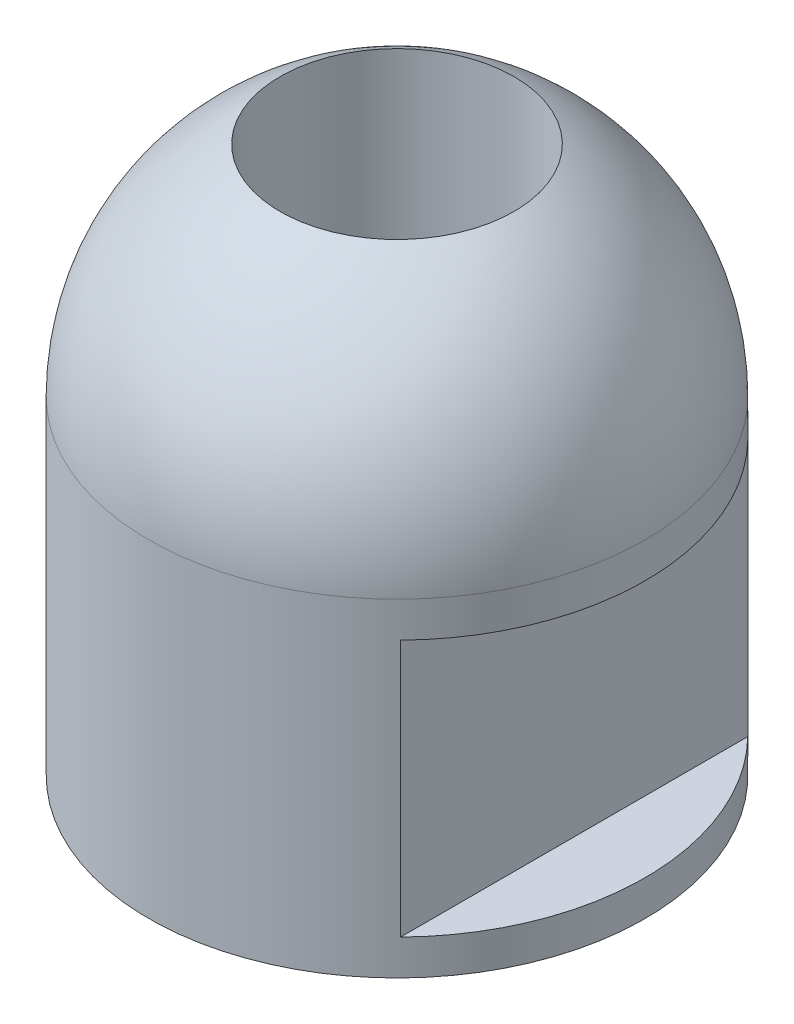
from build123d import *

# Parameters (mm, degrees)
TAP_DRILL_FOR_M4X0_7_TAP1_D = 3.3
CUT_EXTRUDE1_DEPTH          = 10.165790389
CUT_EXTRUDE1_DEPTH_BACK     = 10.165790389
SKETCH5_W                   = 1
SKETCH5_H                   = 3.627718677


with BuildPart() as part:
    # Sketch1 → Revolve1 (revolve)
    with BuildSketch(Plane.XY):
        with BuildLine():
            Line((0, 0), (0, 8.127718677))
            ThreePointArc((0, 8.127718677), (2.474873734, 7.102592411), (3.5, 4.627718677))
            Line((3.5, 4.627718677), (3.5, 0))
            Line((3.5, 0), (0, 0))
        make_face()
    revolve(axis=Axis((0, 8.127718677, 0), (0, 1, 0)))

    # Tap Drill for M4x0.7 Tap1 (through all)
    with Locations(Plane(origin=(0, 0, 0), x_dir=(-1, 0, 0), z_dir=(0, -1, 0))):
        with Locations((0, 0)):
            Hole(TAP_DRILL_FOR_M4X0_7_TAP1_D / 2)

    # Sketch5 → Cut-Extrude1 (cut, two sides: drawn at the far end of the back side and taken through both)
    with BuildSketch(Plane.XY.offset(-CUT_EXTRUDE1_DEPTH_BACK)):
        with Locations((3, 2.313859338)):
            Rectangle(SKETCH5_W, SKETCH5_H)
        with Locations((-3, 2.313859338)):
            Rectangle(SKETCH5_W, SKETCH5_H)
    extrude(amount=CUT_EXTRUDE1_DEPTH + CUT_EXTRUDE1_DEPTH_BACK, mode=Mode.SUBTRACT)


solid = part.part
